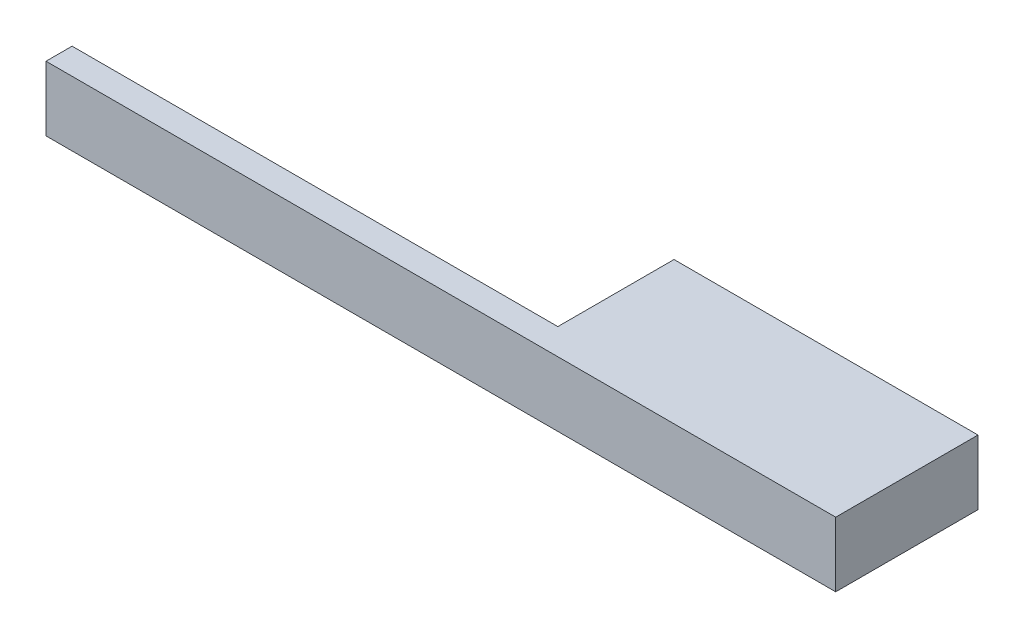
from build123d import *

# Parameters (mm, degrees)
SKETCH1_W           = 47
SKETCH1_H           = 22
BOSS_EXTRUDE1_DEPTH = 10
SKETCH2_W           = 4.035688101
SKETCH2_H           = 10
BOSS_EXTRUDE2_DEPTH = 75.1


with BuildPart() as part:
    # Sketch1 → Boss-Extrude1 (new body)
    with BuildSketch(Plane(origin=(0, 0, 0), x_dir=(1, 0, 0), z_dir=(0, 1, 0))):
        with Locations((23.5, 11)):
            Rectangle(SKETCH1_W, SKETCH1_H)
    extrude(amount=BOSS_EXTRUDE1_DEPTH)

    # Sketch2 → Boss-Extrude2 (add)
    with BuildSketch(Plane.ZY):
        with Locations((-2.01784405, 5)):
            Rectangle(SKETCH2_W, SKETCH2_H)
    extrude(amount=BOSS_EXTRUDE2_DEPTH)


solid = part.part
